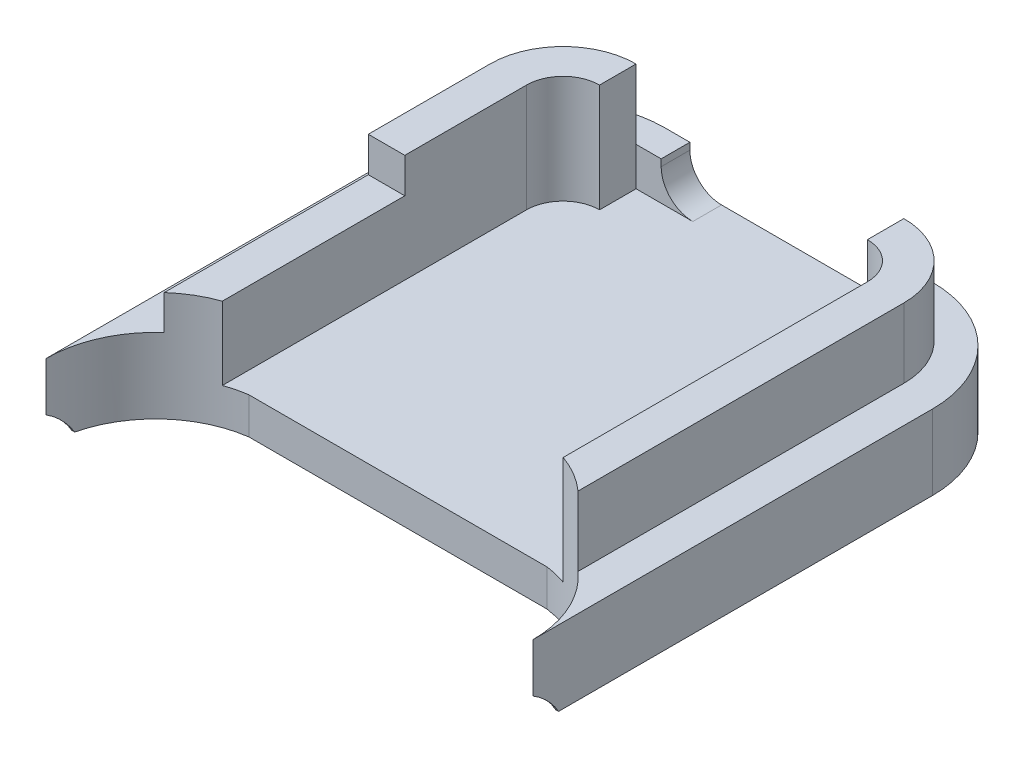
from build123d import *
from OCP.BRepAlgoAPI import BRepAlgoAPI_Cut
from OCP.TopTools import TopTools_ListOfShape

# Parameters (mm, degrees)
BOSS_EXTRUDE6_DEPTH      = 2.5
CUT_EXTRUDE1_DEPTH       = 30.06261
CUT_EXTRUDE1_DEPTH_BACK  = 1.5
BOSS_EXTRUDE7_DEPTH      = 18.5
BOSS_EXTRUDE7_DEPTH_BACK = 1.5
CUT_EXTRUDE2_DEPTH       = 32.362831921
CUT_EXTRUDE2_DEPTH_BACK  = 32.362831921
SKETCH14_R               = 0.75
BOSS_EXTRUDE9_START      = 4.44
SKETCH19_W               = 1.5
SKETCH19_H               = 4
BOSS_EXTRUDE9_DEPTH      = 4.44
SKETCH21_W               = 1.5
SKETCH21_H               = 3
BOSS_EXTRUDE11_DEPTH     = 10
CUT_EXTRUDE3_DEPTH       = 34.819018318
CUT_EXTRUDE3_DEPTH_BACK  = 34.819018318
CUT_EXTRUDE4_DEPTH       = 32.833480802
CUT_EXTRUDE4_DEPTH_BACK  = 32.833480802


with BuildPart() as part:
    # Sketch9 → Boss-Extrude6 (new body)
    with BuildSketch(Plane(origin=(0, 3.23, 0), x_dir=(1, 0, 0), z_dir=(0, 1, 0))):
        with BuildLine():
            Line((3, 25.18), (14, 25.18))
            ThreePointArc((14, 25.18), (17.181980515, 23.861980515), (18.5, 20.68))
            Line((18.5, 20.68), (18.5, 3))
            Line((18.5, 3), (17, 3))
            Line((17, 3), (17, 21))
            ThreePointArc((17, 21), (16.121320344, 23.121320344), (14, 24))
            Line((14, 24), (3, 24))
            ThreePointArc((3, 24), (0.878679656, 23.121320344), (0, 21))
            Line((0, 21), (0, 3))
            Line((0, 3), (-1.5, 3))
            Line((-1.5, 3), (-1.5, 21))
            ThreePointArc((-1.5, 21), (-0.073983127, 23.977063175), (3, 25.18))
        make_face()
    extrude(amount=-BOSS_EXTRUDE6_DEPTH)

    # Sketch7 → Cut-Extrude1 (cut, two sides: drawn at the far end of the back side and taken through both)
    with BuildSketch(Plane(origin=(0, 0, -25.18), x_dir=(-1, 0, 0), z_dir=(0, 0, -1)).offset(-CUT_EXTRUDE1_DEPTH_BACK)):
        with BuildLine():
            Line((-12.97, 3.23), (-4.03, 3.23))
            Line((-4.03, 3.23), (-4.03, 2.95))
            ThreePointArc((-4.03, 2.95), (-4.410761184, 2.030761184), (-5.33, 1.65))
            Line((-5.33, 1.65), (-11.67, 1.65))
            ThreePointArc((-11.67, 1.65), (-12.589238816, 2.030761184), (-12.97, 2.95))
            Line((-12.97, 2.95), (-12.97, 3.23))
        make_face()
    extrude(amount=CUT_EXTRUDE1_DEPTH + CUT_EXTRUDE1_DEPTH_BACK, mode=Mode.SUBTRACT)

    # Sketch12 → Boss-Extrude7 (add, two sides: drawn at the far end of the back side and taken through both)
    with BuildSketch(Plane(origin=(0, 0, 0), x_dir=(0, 0, -1), z_dir=(1, 0, 0)).offset(-BOSS_EXTRUDE7_DEPTH_BACK)):
        Polygon((6.787278953, 1.65), (1.644409133, 1.65), (1.644409133, 0.15), (8.72, 0.15), (25.18, 0.15), (25.18, 1.65), align=None)
    extrude(amount=BOSS_EXTRUDE7_DEPTH + BOSS_EXTRUDE7_DEPTH_BACK)

    # Sketch14 → Cut-Extrude2 (cut, two sides: drawn at the far end of the back side and taken through both)
    # profile 1 of 5: a face of its own
    with BuildSketch(Plane(origin=(0, 2.86, 0), x_dir=(1, 0, 0), z_dir=(0, 1, 0)).offset(-CUT_EXTRUDE2_DEPTH_BACK)):
        Polygon((14.01139117, 26.68), (3.013153393, 26.68), (2.986846607, 26.68), (-3, 26.68), (-3, 21.049560468), (-3, 3), (-3, -2.88), (-3, -8.88), (3, -8.88), (13.998237777, -8.88), (14.024544563, -8.88), (20, -8.88), (20, -3.249560468), (20, 2.630439532), (20, 20.68), (20, 26.68), align=None)
        with BuildLine():
            Line((14, -7.38), (3, -7.38))
            ThreePointArc((3, -7.38), (-0.181980515, -6.061980515), (-1.5, -2.88))
            Line((-1.5, -2.88), (-1.5, 3))
            Line((-1.5, 3), (-1.499971165, 20.691405551))
            ThreePointArc((-1.499971165, 20.691405551), (-0.177940395, 23.866009567), (3, 25.18))
            Line((3, 25.18), (14, 25.18))
            ThreePointArc((14, 25.18), (17.181980515, 23.861980515), (18.5, 20.68))
            Line((18.5, 20.68), (18.5, 3))
            Line((18.5, 3), (18.5, -2.88))
            ThreePointArc((18.5, -2.88), (17.181980515, -6.061980515), (14, -7.38))
        make_face(mode=Mode.SUBTRACT)
    # profile 2 of 5: a face of its own
    with BuildSketch(Plane(origin=(0, 2.86, 0), x_dir=(1, 0, 0), z_dir=(0, 1, 0)).offset(-CUT_EXTRUDE2_DEPTH_BACK)):
        with Locations((4.75, 1.52)):
            Circle(SKETCH14_R)
    # profile 3 of 5: a face of its own
    with BuildSketch(Plane(origin=(0, 2.86, 0), x_dir=(1, 0, 0), z_dir=(0, 1, 0)).offset(-CUT_EXTRUDE2_DEPTH_BACK)):
        with Locations((7.25, 1.52)):
            Circle(SKETCH14_R)
    # profile 4 of 5: a face of its own
    with BuildSketch(Plane(origin=(0, 2.86, 0), x_dir=(1, 0, 0), z_dir=(0, 1, 0)).offset(-CUT_EXTRUDE2_DEPTH_BACK)):
        with Locations((9.75, 1.52)):
            Circle(SKETCH14_R)
    # profile 5 of 5: a face of its own
    with BuildSketch(Plane(origin=(0, 2.86, 0), x_dir=(1, 0, 0), z_dir=(0, 1, 0)).offset(-CUT_EXTRUDE2_DEPTH_BACK)):
        with Locations((12.25, 1.52)):
            Circle(SKETCH14_R)
    extrude(amount=CUT_EXTRUDE2_DEPTH + CUT_EXTRUDE2_DEPTH_BACK, mode=Mode.SUBTRACT)

    # Sketch19 → Boss-Extrude9 (add)
    with BuildSketch(Plane(origin=(0, 1.65, 0), x_dir=(1, 0, 0), z_dir=(0, 1, 0)).offset(BOSS_EXTRUDE9_START)):
        with BuildLine():
            Line((17, 21), (17, 16))
            Line((17, 16), (17, 7))
            Line((17, 7), (17, 3))
            Line((17, 3), (15.5, 3))
            Line((15.5, 3), (15.5, 7))
            Line((15.5, 7), (15.5, 16))
            Line((15.5, 16), (15.5, 21))
            ThreePointArc((15.5, 21), (15.060660172, 22.060660172), (14, 22.5))
            Line((14, 22.5), (14, 24))
            ThreePointArc((14, 24), (16.121320344, 23.121320344), (17, 21))
        make_face()
        with BuildLine():
            Line((0, 21), (0, 16))
            Line((0, 16), (1.5, 16))
            Line((1.5, 16), (1.5, 21))
            ThreePointArc((1.5, 21), (1.939339828, 22.060660172), (3, 22.5))
            Line((3, 22.5), (3, 24))
            ThreePointArc((3, 24), (0.878679656, 23.121320344), (0, 21))
        make_face()
        with Locations((0.75, 5)):
            Rectangle(SKETCH19_W, SKETCH19_H)
    extrude(amount=-BOSS_EXTRUDE9_DEPTH)

    # Sketch21 → Boss-Extrude11 (add)
    with BuildSketch(Plane.XY.offset(-16)):
        with Locations((0.75, 3.15)):
            Rectangle(SKETCH21_W, SKETCH21_H)
    extrude(amount=BOSS_EXTRUDE11_DEPTH)


with BuildPart() as cut_extrude3_tool:
    # Sketch17 → Cut-Extrude3 (new, two sides: drawn at the far end of the back side and taken through both)
    with BuildSketch(Plane(origin=(0, -6.85, 0), x_dir=(-1, 0, 0), z_dir=(0, -1, 0)).offset(-CUT_EXTRUDE3_DEPTH_BACK)):
        with BuildLine():
            Line((-14.620622145, 8.72), (-2.379377855, 8.72))
            ThreePointArc((-2.379377855, 8.72), (0.394318757, 7.217422785), (1.5, 4.263002339))
            Line((1.5, 4.263002339), (1.5, -1.5))
            Line((1.5, -1.5), (-18.5, -1.5))
            Line((-18.5, -1.5), (-18.5, 4.263002339))
            ThreePointArc((-18.5, 4.263002339), (-17.394318757, 7.217422785), (-14.620622145, 8.72))
        make_face()
    extrude(amount=CUT_EXTRUDE3_DEPTH + CUT_EXTRUDE3_DEPTH_BACK)


with BuildPart() as part_1:
    add(part.part)

    # Cut-Extrude3: cut by cut_extrude3_tool, with a tolerance
    cut_extrude3_stock = TopTools_ListOfShape()
    cut_extrude3_stock.Append(part_1.part.wrapped)
    cut_extrude3_tools = TopTools_ListOfShape()
    cut_extrude3_tools.Append(cut_extrude3_tool.part.wrapped)
    cut_extrude3_cut = BRepAlgoAPI_Cut()
    cut_extrude3_cut.SetArguments(cut_extrude3_stock)
    cut_extrude3_cut.SetTools(cut_extrude3_tools)
    cut_extrude3_cut.SetFuzzyValue(0.00001)
    cut_extrude3_cut.Build()
    add(Compound.cast(cut_extrude3_cut.Shape()).solids(), mode=Mode.REPLACE)

    # Sketch20 → Cut-Extrude4 (cut, two sides: drawn at the far end of the back side and taken through both)
    with BuildSketch(Plane(origin=(0, 0, 0), x_dir=(0, 0, -1), z_dir=(1, 0, 0)).offset(-CUT_EXTRUDE4_DEPTH_BACK)):
        with BuildLine():
            Line((-1.38, 1.65), (0.12, 1.65))
            Line((0.12, 1.65), (2.72, 1.65))
            ThreePointArc((2.72, 1.65), (4.841320344, 0.771320344), (5.72, -1.35))
            Line((5.72, -1.35), (5.72, -6.35))
            Line((5.72, -6.35), (5.72, -7.888681431))
            Line((5.72, -7.888681431), (-4.38, -7.888681431))
            Line((-4.38, -7.888681431), (-4.38, -6.35))
            Line((-4.38, -6.35), (-4.38, -1.35))
            ThreePointArc((-4.38, -1.35), (-3.501320344, 0.771320344), (-1.38, 1.65))
        make_face()
    extrude(amount=CUT_EXTRUDE4_DEPTH + CUT_EXTRUDE4_DEPTH_BACK, mode=Mode.SUBTRACT)


solid = part_1.part
